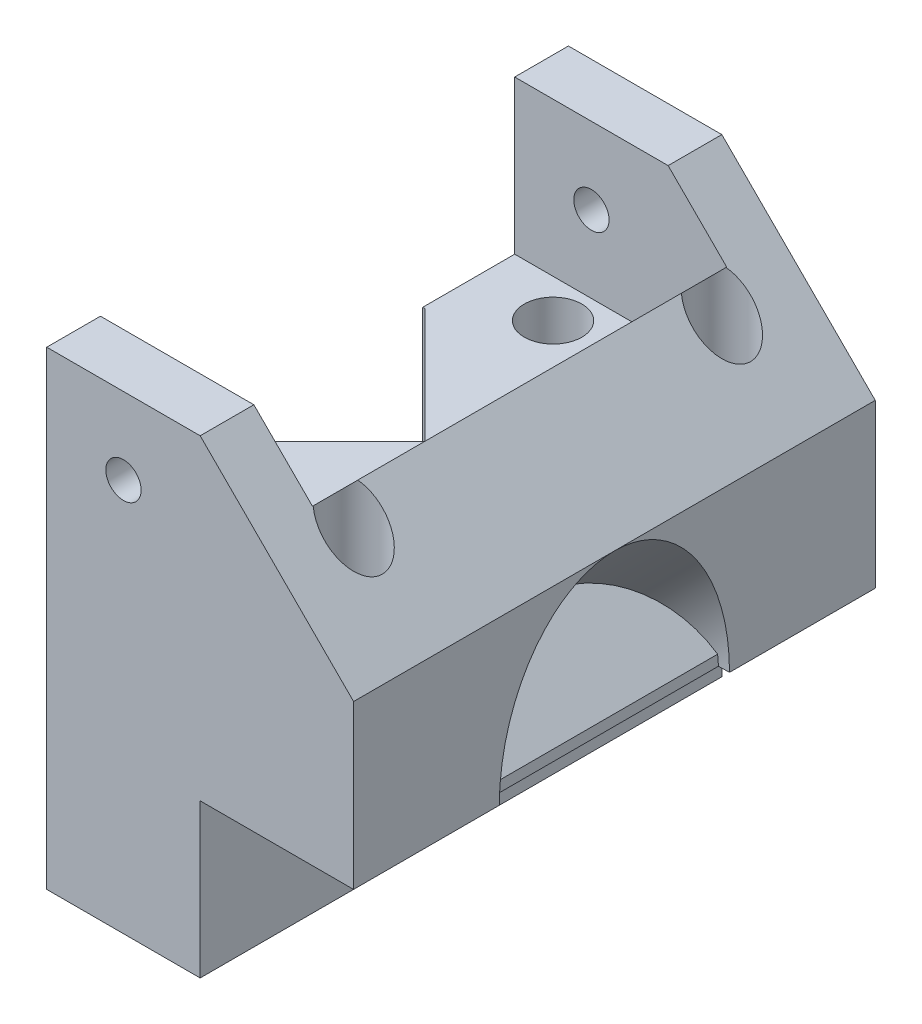
from build123d import *

# Parameters (mm, degrees)
AUFSATZ_LINEAR_AUSTRAGEN1_DEPTH = 68
SKIZZE4_R                       = 15
SCHNITT_LINEAR_AUSTRAGEN1_DEPTH = 20
SKIZZE9_W                       = 27.635547715
SKIZZE9_H                       = 54
SCHNITT_LINEAR_AUSTRAGEN6_DEPTH = 20
SKIZZE5_R                       = 2.3
SCHNITT_LINEAR_AUSTRAGEN2_DEPTH = 20
SKIZZE6_R                       = 3.75
SCHNITT_LINEAR_AUSTRAGEN3_DEPTH = 96.723933406
SKIZZE7_R                       = 2.3
SCHNITT_LINEAR_AUSTRAGEN4_DEPTH = 20
SKIZZE8_R                       = 3.75
SCHNITT_LINEAR_AUSTRAGEN5_DEPTH = 86.991530335
FASE1_SIZE                      = 12.36
SKIZZE10_W                      = 15.275547715
SKIZZE10_H                      = 30
SCHNITT_LINEAR_AUSTRAGEN7_DEPTH = 31.213203436
FASE2_SIZE                      = 15
SKIZZE12_R                      = 2.3
SCHNITT_LINEAR_AUSTRAGEN8_DEPTH = 100.855176505
FASE3_SIZE                      = 2
FASE3_SIZE2                     = 1.414213562


with BuildPart() as part:
    # Skizze1 → Aufsatz-Linear austragen1 (new body)
    with BuildSketch(Plane.XY):
        Polygon((0, 0), (20, 0), (20, 20), (40, 20), (40, 41.213203436), (20, 61.213203436), (0, 61.213203436), align=None)
    extrude(amount=-AUFSATZ_LINEAR_AUSTRAGEN1_DEPTH)

    # Skizze4 → Schnitt-Linear austragen1 (cut)
    with BuildSketch(Plane(origin=(30, 30, 0), x_dir=(0, 0, 1), z_dir=(-0.7071067811865507, -0.7071067811865445, -1.0200465955922179e-15))):
        with Locations((-34, -14.142135624)):
            Circle(SKIZZE4_R)
    extrude(amount=-SCHNITT_LINEAR_AUSTRAGEN1_DEPTH, mode=Mode.SUBTRACT)

    # Skizze9 → Schnitt-Linear austragen6 (cut)
    with BuildSketch(Plane(origin=(0, 61.213203436, 0), x_dir=(1, 0, 0), z_dir=(0, 1, 0))):
        with Locations((13.817773858, 34)):
            Rectangle(SKIZZE9_W, SKIZZE9_H)
    extrude(amount=-SCHNITT_LINEAR_AUSTRAGEN6_DEPTH, mode=Mode.SUBTRACT)

    # Skizze5 → Schnitt-Linear austragen2 (cut)
    with BuildSketch(Plane(origin=(0, 7, 0), x_dir=(-1, 0, 0), z_dir=(0, -1, 0))):
        with Locations(Location((-10, 56, 0), (0, 0, 180))):
            Circle(SKIZZE5_R)
        with Locations((-10, 12)):
            Circle(SKIZZE5_R)
    extrude(amount=SCHNITT_LINEAR_AUSTRAGEN2_DEPTH, mode=Mode.SUBTRACT)

    # Skizze6 → Schnitt-Linear austragen3 (cut, through all)
    with BuildSketch(Plane(origin=(0, 7, 0), x_dir=(-1, 0, 0), z_dir=(0, -1, 0))):
        with Locations(Location((-10, 56, 0), (0, 0, 180))):
            Circle(SKIZZE6_R)
        with Locations(Location((-10, 12, 0), (0, 0, 180))):
            Circle(SKIZZE6_R)
    extrude(amount=-SCHNITT_LINEAR_AUSTRAGEN3_DEPTH, mode=Mode.SUBTRACT)

    # Skizze7 → Schnitt-Linear austragen4 (cut)
    with BuildSketch(Plane(origin=(0, 27, 0), x_dir=(-1, 0, 0), z_dir=(0, -1, 0))):
        with Locations(Location((-30, 58, 0), (0, 0, 180))):
            Circle(SKIZZE7_R)
        with Locations((-30, 10)):
            Circle(SKIZZE7_R)
    extrude(amount=SCHNITT_LINEAR_AUSTRAGEN4_DEPTH, mode=Mode.SUBTRACT)

    # Skizze8 → Schnitt-Linear austragen5 (cut, through all)
    with BuildSketch(Plane(origin=(0, 27, 0), x_dir=(-1, 0, 0), z_dir=(0, -1, 0))):
        with Locations(Location((-30, 58, 0), (0, 0, 180))):
            Circle(SKIZZE8_R)
        with Locations(Location((-30, 10, 0), (0, 0, 180))):
            Circle(SKIZZE8_R)
    extrude(amount=-SCHNITT_LINEAR_AUSTRAGEN5_DEPTH, mode=Mode.SUBTRACT)

    # Fase1
    fase1_edges = [part.edges().sort_by_distance(p)[0] for p in [
        (27.635547715, 41.213203436, -34),
    ]]
    chamfer(fase1_edges, length=FASE1_SIZE)

    # Skizze10 → Schnitt-Linear austragen7 (cut)
    with BuildSketch(Plane(origin=(0, 41.213203436, 0), x_dir=(1, 0, 0), z_dir=(0, 1, 0))):
        with Locations((7.637773858, 34)):
            Rectangle(SKIZZE10_W, SKIZZE10_H)
    extrude(amount=-SCHNITT_LINEAR_AUSTRAGEN7_DEPTH, mode=Mode.SUBTRACT)

    # Fase2
    fase2_edges = [part.edges().sort_by_distance(p)[0] for p in [
        (15.275547715, 25.606601718, -19),
        (15.275547715, 25.606601718, -49),
    ]]
    chamfer(fase2_edges, length=FASE2_SIZE - 0.0001)  # a hair under: the kernel refuses the full size

    # Skizze12 → Schnitt-Linear austragen8 (cut, through all)
    with BuildSketch(Plane(origin=(0, 0, -68), x_dir=(-1, 0, 0), z_dir=(0, 0, -1))):
        with Locations((-10, 51.213203436)):
            Circle(SKIZZE12_R)
    extrude(amount=-SCHNITT_LINEAR_AUSTRAGEN8_DEPTH, mode=Mode.SUBTRACT)

    # Fase3
    fase3_edges = [part.edges().sort_by_distance(p)[0] for p in [
        (40, 20, -34),
    ]]
    fase3_side = [part.faces().sort_by_distance(p)[0] for p in [
        (35.498418419, 24.501581581, -34),
    ]]
    chamfer(fase3_edges, length=FASE3_SIZE, length2=FASE3_SIZE2, reference=fase3_side[0])


solid = part.part
